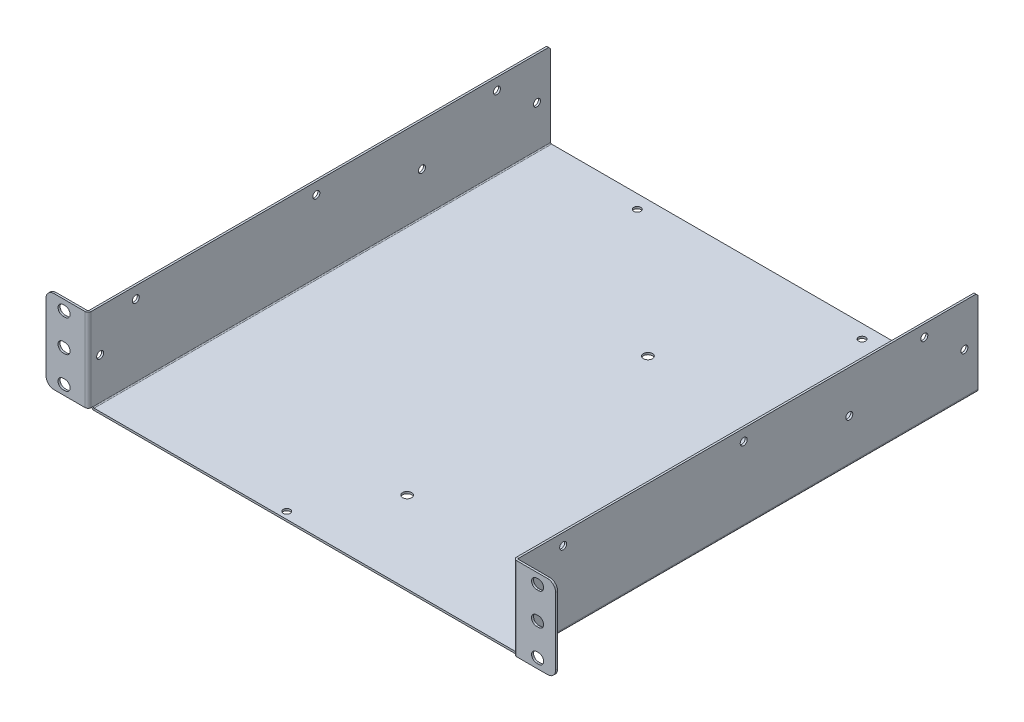
from build123d import *

# Parameters (mm, degrees)
SKETCH1_W                    = 214
SKETCH1_H                    = 230.5
BASE_FLANGE1_DEPTH           = 1
EDGE_FLANGE3_STRIP_W         = 5
EDGE_FLANGE3_STRIP_H         = 1
EDGE_FLANGE3_STRIP_CUT_DEPTH = 230.5
EDGE_FLANGE3_DEPTH           = 230.5
EDGE_FLANGE4_STRIP_W         = 5
EDGE_FLANGE4_STRIP_H         = 1
EDGE_FLANGE4_STRIP_CUT_DEPTH = 230.5
EDGE_FLANGE4_DEPTH           = 230.5
EDGE_FLANGE5_STRIP_W         = 5
EDGE_FLANGE5_STRIP_H         = 1
EDGE_FLANGE5_STRIP_CUT_DEPTH = 41.5
EDGE_FLANGE5_DEPTH           = 41.5
EDGE_FLANGE6_STRIP_W         = 5
EDGE_FLANGE6_STRIP_H         = 1
EDGE_FLANGE6_STRIP_CUT_DEPTH = 41.5
EDGE_FLANGE6_DEPTH           = 41.5
FILLET1_R                    = 4
CUT_EXTRUDE1_REACH           = 178.807
SKETCH24_W                   = 214
SKETCH24_H                   = 2.5
SKETCH26_R                   = 2.5
CUT_EXTRUDE2_DEPTH           = 10
SKETCH27_R                   = 1.75
CUT_EXTRUDE3_DEPTH           = 265.201745831
SKETCH28_R                   = 2.25
CUT_EXTRUDE4_DEPTH           = 177.806568034
SKETCH29_R                   = 1.75
CUT_EXTRUDE5_DEPTH           = 177.566028726
SKETCH30_R                   = 1.75
CUT_EXTRUDE6_DEPTH           = 265.201745831
SKETCH31_R                   = 1.75
CUT_EXTRUDE7_DEPTH           = 265.201745831
CHAMFER1_SIZE                = 1
CUT_EXTRUDE8_DEPTH           = 266.637440885
SKETCH33_R                   = 1.75
CUT_EXTRUDE9_DEPTH           = 177.806568034
SKETCH34_R                   = 1.75
CUT_EXTRUDE10_DEPTH          = 265.201745831


# Sheet-metal steps are written as plain solids
with BuildPart() as part:
    # Sketch1 → Base-Flange1 (new body)
    with BuildSketch(Plane(origin=(0, 0, 0), x_dir=(1, 0, 0), z_dir=(0, 1, 0))):
        Rectangle(SKETCH1_W, SKETCH1_H)
    extrude(amount=-BASE_FLANGE1_DEPTH)

    # Edge-Flange3 strip (across the edge) → Edge-Flange3 strip cut (cut)
    with BuildSketch(Plane(origin=(-107, 0, -115.25), x_dir=(1, 0, 0), z_dir=(0, 0, 1))):
        with Locations((-1, -0.5)):
            Rectangle(EDGE_FLANGE3_STRIP_W, EDGE_FLANGE3_STRIP_H)
    extrude(amount=EDGE_FLANGE3_STRIP_CUT_DEPTH, mode=Mode.SUBTRACT)

    # Edge-Flange3 section (across the edge) → Edge-Flange3 (add)
    with BuildSketch(Plane(origin=(-107, 0, -115.25), x_dir=(1, 0, 0), z_dir=(0, 0, 1))):
        with BuildLine():
            Line((0, 0.5), (0, 42))
            Line((0, 42), (1, 42))
            Line((1, 42), (1, 0.5))
            ThreePointArc((1, 0.5), (1.146446609, 0.146446609), (1.5, 0))
            Line((1.5, 0), (1.5, -1))
            ThreePointArc((1.5, -1), (0.439339828, -0.560660172), (0, 0.5))
        make_face()
    extrude(amount=EDGE_FLANGE3_DEPTH)

    # Edge-Flange4 strip (across the edge) → Edge-Flange4 strip cut (cut)
    with BuildSketch(Plane(origin=(107, 0, 115.25), x_dir=(-1, 0, 0), z_dir=(0, 0, -1))):
        with Locations((-1, -0.5)):
            Rectangle(EDGE_FLANGE4_STRIP_W, EDGE_FLANGE4_STRIP_H)
    extrude(amount=EDGE_FLANGE4_STRIP_CUT_DEPTH, mode=Mode.SUBTRACT)

    # Edge-Flange4 section (across the edge) → Edge-Flange4 (add)
    with BuildSketch(Plane(origin=(107, 0, 115.25), x_dir=(-1, 0, 0), z_dir=(0, 0, -1))):
        with BuildLine():
            Line((0, 0.5), (0, 42))
            Line((0, 42), (1, 42))
            Line((1, 42), (1, 0.5))
            ThreePointArc((1, 0.5), (1.146446609, 0.146446609), (1.5, 0))
            Line((1.5, 0), (1.5, -1))
            ThreePointArc((1.5, -1), (0.439339828, -0.560660172), (0, 0.5))
        make_face()
    extrude(amount=EDGE_FLANGE4_DEPTH)

    # Edge-Flange5 strip (across the edge) → Edge-Flange5 strip cut (cut)
    with BuildSketch(Plane(origin=(107, 42, 115.25), x_dir=(0, 0, -1), z_dir=(0, -1, 0))):
        with Locations((-1, -0.5)):
            Rectangle(EDGE_FLANGE5_STRIP_W, EDGE_FLANGE5_STRIP_H)
    extrude(amount=EDGE_FLANGE5_STRIP_CUT_DEPTH, mode=Mode.SUBTRACT)

    # Edge-Flange5 section (across the edge) → Edge-Flange5 (add)
    with BuildSketch(Plane(origin=(107, 42, 115.25), x_dir=(0, 0, -1), z_dir=(0, -1, 0))):
        with BuildLine():
            Line((0, 0.5), (0, 20))
            Line((0, 20), (1, 20))
            Line((1, 20), (1, 0.5))
            ThreePointArc((1, 0.5), (1.146446609, 0.146446609), (1.5, 0))
            Line((1.5, 0), (1.5, -1))
            ThreePointArc((1.5, -1), (0.439339828, -0.560660172), (0, 0.5))
        make_face()
    extrude(amount=EDGE_FLANGE5_DEPTH)

    # Edge-Flange6 strip (across the edge) → Edge-Flange6 strip cut (cut)
    with BuildSketch(Plane(origin=(-107, 0.5, 115.25), x_dir=(0, 0, -1), z_dir=(0, 1, 0))):
        with Locations((-1, -0.5)):
            Rectangle(EDGE_FLANGE6_STRIP_W, EDGE_FLANGE6_STRIP_H)
    extrude(amount=EDGE_FLANGE6_STRIP_CUT_DEPTH, mode=Mode.SUBTRACT)

    # Edge-Flange6 section (across the edge) → Edge-Flange6 (add)
    with BuildSketch(Plane(origin=(-107, 0.5, 115.25), x_dir=(0, 0, -1), z_dir=(0, 1, 0))):
        with BuildLine():
            Line((0, 0.5), (0, 20))
            Line((0, 20), (1, 20))
            Line((1, 20), (1, 0.5))
            ThreePointArc((1, 0.5), (1.146446609, 0.146446609), (1.5, 0))
            Line((1.5, 0), (1.5, -1))
            ThreePointArc((1.5, -1), (0.439339828, -0.560660172), (0, 0.5))
        make_face()
    extrude(amount=EDGE_FLANGE6_DEPTH)

    # Fillet1
    fillet1_edges = [part.edges().sort_by_distance(p)[0] for p in [
        (127, 42, 114.75),
        (127, 0.5, 114.75),
        (-127, 0.5, 114.75),
        (-127, 42, 114.75),
    ]]
    fillet(fillet1_edges, radius=FILLET1_R)

    # Cut-Extrude1: up to this face of the body (flat: up to its plane)
    cut_extrude1_end = Plane(part.part.faces().sort_by_distance((114.980552593, 0.5, 114.747536063))[0])
    # Sketch24 → Cut-Extrude1 (cut, up to the picked face)
    with BuildSketch(Plane.XZ.offset(1), mode=Mode.PRIVATE) as cut_extrude1_sk1:
        with Locations((0, 114)):
            Rectangle(SKETCH24_W, SKETCH24_H)
    cut_extrude1_tool1 = split(extrude(cut_extrude1_sk1.sketch, amount=-CUT_EXTRUDE1_REACH, mode=Mode.PRIVATE), bisect_by=cut_extrude1_end, keep=Keep.BOTH, mode=Mode.PRIVATE)
    add(cut_extrude1_tool1.solids().sort_by(Axis((0, -1, 114), (0, 1, 0)))[0], mode=Mode.SUBTRACT)

    # Sketch26 → Cut-Extrude2 (cut)
    with BuildSketch(Plane.XY.offset(115.25)):
        with Locations((-118, 37)):
            Circle(SKETCH26_R)
        with Locations((-118, 5.24)):
            Circle(SKETCH26_R)
        with Locations((-118, 21.12)):
            Circle(SKETCH26_R)
        with Locations(Location((118, 5.24, 0), (0, 0, 180))):
            Circle(SKETCH26_R)
        with Locations(Location((118, 21.12, 0), (0, 0, 180))):
            Circle(SKETCH26_R)
        with Locations(Location((118, 37, 0), (0, 0, 180))):
            Circle(SKETCH26_R)
    extrude(amount=-CUT_EXTRUDE2_DEPTH, mode=Mode.SUBTRACT)

    # Sketch27 → Cut-Extrude3 (cut, through all)
    with BuildSketch(Plane(origin=(107, 0, 0), x_dir=(0, 0, -1), z_dir=(1, 0, 0))):
        with Locations(Location((-91.5, 36.25, 0), (0, 0, 90))):
            Circle(SKETCH27_R)
        with Locations(Location((-1.5, 36.25, 0), (0, 0, 90))):
            Circle(SKETCH27_R)
        with Locations(Location((88.5, 36.25, 0), (0, 0, 90))):
            Circle(SKETCH27_R)
    extrude(amount=-CUT_EXTRUDE3_DEPTH, mode=Mode.SUBTRACT)

    # Sketch28 → Cut-Extrude4 (cut, through all)
    with BuildSketch(Plane.XZ.offset(1)):
        with Locations(Location((10, 72.25, 0), (0, 0, 270))):
            Circle(SKETCH28_R)
        with Locations(Location((85, 72.25, 0), (0, 0, 270))):
            Circle(SKETCH28_R)
        with Locations(Location((10, -47.75, 0), (0, 0, 270))):
            Circle(SKETCH28_R)
        with Locations(Location((85, -47.75, 0), (0, 0, 270))):
            Circle(SKETCH28_R)
    extrude(amount=-CUT_EXTRUDE4_DEPTH, mode=Mode.SUBTRACT)

    # Sketch29 → Cut-Extrude5 (cut, through all)
    with BuildSketch(Plane(origin=(0, 0, 0), x_dir=(1, 0, 0), z_dir=(0, 1, 0))):
        with Locations(Location((56, 108.45, 0), (0, 0, 270))):
            Circle(SKETCH29_R)
        with Locations(Location((-56, 108.45, 0), (0, 0, 270))):
            Circle(SKETCH29_R)
    extrude(amount=-CUT_EXTRUDE5_DEPTH, mode=Mode.SUBTRACT)

    # Sketch30 → Cut-Extrude6 (cut, through all)
    with BuildSketch(Plane.ZY.offset(107)):
        with Locations(Location((-51.1, 21, 0), (0, 0, 270))):
            Circle(SKETCH30_R)
    extrude(amount=-CUT_EXTRUDE6_DEPTH, mode=Mode.SUBTRACT)

    # Sketch31 → Cut-Extrude7 (cut, through all)
    with BuildSketch(Plane.ZY.offset(107)):
        with Locations(Location((-108.45, 21, 0), (0, 0, 270))):
            Circle(SKETCH31_R)
    extrude(amount=-CUT_EXTRUDE7_DEPTH, mode=Mode.SUBTRACT)

    # Chamfer1
    chamfer1_edges = [part.edges().sort_by_distance(p)[0] for p in [
        (-106.5, 42, -115.25),
        (106.5, 42, -115.25),
    ]]
    chamfer(chamfer1_edges, length=CHAMFER1_SIZE)

    # Sketch32 → Cut-Extrude8 (cut, through all)
    with BuildSketch(Plane(origin=(0, 0, 114.25), x_dir=(-1, 0, 0), z_dir=(0, 0, -1))):
        with BuildLine():
            Line((117.5, 39.5), (118.5, 39.5))
            ThreePointArc((118.5, 39.5), (121, 37), (118.5, 34.5))
            Line((118.5, 34.5), (117.5, 34.5))
            ThreePointArc((117.5, 34.5), (115, 37), (117.5, 39.5))
        make_face()
        with BuildLine():
            Line((117.5, 23.62), (118.5, 23.62))
            ThreePointArc((118.5, 23.62), (121, 21.12), (118.5, 18.62))
            Line((118.5, 18.62), (117.5, 18.62))
            ThreePointArc((117.5, 18.62), (115, 21.12), (117.5, 23.62))
        make_face()
        with BuildLine():
            Line((117.5, 7.74), (118.5, 7.74))
            ThreePointArc((118.5, 7.74), (121, 5.24), (118.5, 2.74))
            Line((118.5, 2.74), (117.5, 2.74))
            ThreePointArc((117.5, 2.74), (115, 5.24), (117.5, 7.74))
        make_face()
    cut_extrude8 = extrude(amount=-CUT_EXTRUDE8_DEPTH, mode=Mode.SUBTRACT)

    # Mirror1: Cut-Extrude8 across plane
    add(cut_extrude8.mirror(Plane(origin=(0, 0, 0), x_dir=(0, 0, 1), z_dir=(1, 0, 0))), mode=Mode.SUBTRACT)

    # Sketch33 → Cut-Extrude9 (cut, through all)
    with BuildSketch(Plane.XZ.offset(1)):
        with Locations(Location((-13, 109.25, 0), (0, 0, 270))):
            Circle(SKETCH33_R)
    extrude(amount=-CUT_EXTRUDE9_DEPTH, mode=Mode.SUBTRACT)

    # Sketch34 → Cut-Extrude10 (cut, through all)
    with BuildSketch(Plane.ZY.offset(107)):
        with Locations(Location((109.25, 21, 0), (0, 0, 270))):
            Circle(SKETCH34_R)
    extrude(amount=-CUT_EXTRUDE10_DEPTH, mode=Mode.SUBTRACT)


solid = part.part
